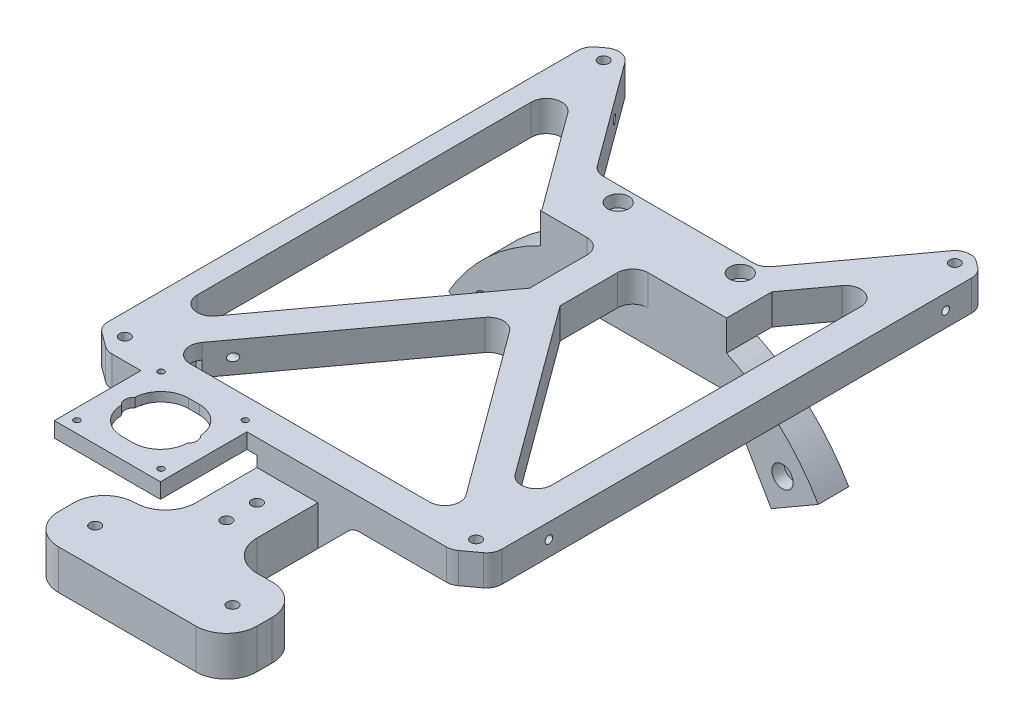
from build123d import *

# Parameters (mm, degrees)
BOSS_EXTRU_1_DEPTH       = 10
ESQUISSE2_W              = 61.02458521
ESQUISSE2_H              = 20
BOSS_EXTRU_2_DEPTH       = 10
ENL_V_MAT_EXTRU_3_REACH  = 98.935
ESQUISSE5_R              = 1.75
ENL_V_MAT_EXTRU_1_REACH  = 79.187
ESQUISSE3_R              = 1.75
ESQUISSE4_R              = 3.5
ENL_V_MAT_EXTRU_2_DEPTH  = 4
ESQUISSE6_R              = 3.5
ENL_V_MAT_EXTRU_4_DEPTH  = 4
ESQUISSE7_R              = 1.75
BOSS_EXTRU_3_DEPTH       = 10
BOSS_EXTRU_4_DEPTH       = 10
ESQUISSE9_R              = 3.5
ENL_V_MAT_EXTRU_5_DEPTH  = 3
BOSS_EXTRU_5_DEPTH       = 13
ENL_V_MAT_EXTRU_6_REACH  = 192.901
ESQUISSE11_R             = 1.75
ENL_V_MAT_EXTRU_9_REACH  = 192.901
ESQUISSE14_R             = 1.75
CONG_2_R                 = 5
CONG_1_R                 = 10
ESQUISSE12_R             = 3.5
ENL_V_MAT_EXTRU_7_DEPTH  = 4.75
ESQUISSE15_R             = 3.5
ENL_V_MAT_EXTRU_10_DEPTH = 7
ENL_V_MAT_EXTRU_11_DEPTH = 5
BOSS_EXTRU_6_DEPTH       = 5
ENL_V_MAT_EXTRU_14_REACH = 195.78
ESQUISSE17_R             = 1
ENL_V_MAT_EXTRU_15_DEPTH = 2
ESQUISSE20_R             = 1.25
ENL_V_MAT_EXTRU_16_DEPTH = 231.047492928
CHANFREIN1_SIZE          = 11.5
CONG_3_R                 = 5
CONG_4_R                 = 9


# Some blends are built 0.0001 mm under size
with BuildPart() as part:
    # Esquisse1 → Boss.-Extru.1 (new body)
    with BuildSketch(Plane.XY):
        with BuildLine():
            Line((-30.13, 52.18), (30.13, 52.18))
            Line((30.13, 52.18), (45.13, 26.199237886))
            Line((45.13, 26.199237886), (60.55958005, 35.107510082))
            ThreePointArc((60.55958005, 35.107510082), (47.623725659, 51.302833784), (30.512292605, 63))
            Line((30.512292605, 63), (-30.512292605, 63))
            ThreePointArc((-30.512292605, 63), (-47.623725659, 51.302833784), (-60.55958005, 35.107510082))
            Line((-60.55958005, 35.107510082), (-45.13, 26.199237886))
            Line((-45.13, 26.199237886), (-30.13, 52.18))
        make_face()
    extrude(amount=BOSS_EXTRU_1_DEPTH)

    # Esquisse2 → Boss.-Extru.2 (add)
    with BuildSketch(Plane(origin=(0, 63, 0), x_dir=(1, 0, 0), z_dir=(0, 1, 0))):
        Rectangle(ESQUISSE2_W, ESQUISSE2_H)
    extrude(amount=BOSS_EXTRU_2_DEPTH)

    # Esquisse5 → Enlèv. mat.-Extru.3 (cut, up to next)
    with BuildSketch(Plane.XY.offset(10), mode=Mode.PRIVATE) as enl_v_mat_extru_3_sk1:
        with Locations((-48.825935482, 37.18)):
            Circle(ESQUISSE5_R)
    enl_v_mat_extru_3_tool1 = extrude(enl_v_mat_extru_3_sk1.sketch, amount=-ENL_V_MAT_EXTRU_3_REACH, mode=Mode.PRIVATE) & part.part
    # Esquisse5 → Enlèv. mat.-Extru.3 (cut, up to next)
    with BuildSketch(Plane.XY.offset(10), mode=Mode.PRIVATE) as enl_v_mat_extru_3_sk2:
        with Locations((48.825935482, 37.18)):
            Circle(ESQUISSE5_R)
    enl_v_mat_extru_3_tool2 = extrude(enl_v_mat_extru_3_sk2.sketch, amount=-ENL_V_MAT_EXTRU_3_REACH, mode=Mode.PRIVATE) & part.part
    add(enl_v_mat_extru_3_tool1.solids().sort_by_distance((-48.825935, 37.18, 10))[0], mode=Mode.SUBTRACT)
    add(enl_v_mat_extru_3_tool2.solids().sort_by_distance((48.825935, 37.18, 10))[0], mode=Mode.SUBTRACT)

    # Esquisse3 → Enlèv. mat.-Extru.1 (cut, up to next)
    with BuildSketch(Plane(origin=(0, 73, 0), x_dir=(1, 0, 0), z_dir=(0, 1, 0)), mode=Mode.PRIVATE) as enl_v_mat_extru_1_sk1:
        with Locations(Location((20, 5, 0), (0, 0, 270))):
            Circle(ESQUISSE3_R)
    enl_v_mat_extru_1_tool1 = extrude(enl_v_mat_extru_1_sk1.sketch, amount=-ENL_V_MAT_EXTRU_1_REACH, mode=Mode.PRIVATE) & part.part
    # Esquisse3 → Enlèv. mat.-Extru.1 (cut, up to next)
    with BuildSketch(Plane(origin=(0, 73, 0), x_dir=(1, 0, 0), z_dir=(0, 1, 0)), mode=Mode.PRIVATE) as enl_v_mat_extru_1_sk2:
        with Locations(Location((-20, 5, 0), (0, 0, 270))):
            Circle(ESQUISSE3_R)
    enl_v_mat_extru_1_tool2 = extrude(enl_v_mat_extru_1_sk2.sketch, amount=-ENL_V_MAT_EXTRU_1_REACH, mode=Mode.PRIVATE) & part.part
    add(enl_v_mat_extru_1_tool1.solids().sort_by_distance((20, 73, -5))[0], mode=Mode.SUBTRACT)
    add(enl_v_mat_extru_1_tool2.solids().sort_by_distance((-20, 73, -5))[0], mode=Mode.SUBTRACT)

    # Esquisse4 → Enlèv. mat.-Extru.2 (cut)
    with BuildSketch(Plane(origin=(0, 73, 0), x_dir=(1, 0, 0), z_dir=(0, 1, 0))):
        with Locations(Location((20, 5, 0), (0, 0, 270))):
            Circle(ESQUISSE4_R)
        with Locations(Location((-20, 5, 0), (0, 0, 270))):
            Circle(ESQUISSE4_R)
    extrude(amount=-ENL_V_MAT_EXTRU_2_DEPTH, mode=Mode.SUBTRACT)

    # Esquisse6 → Enlèv. mat.-Extru.4 (cut)
    with BuildSketch(Plane.XY.offset(10)):
        with Locations((-48.825935482, 37.18)):
            Circle(ESQUISSE6_R)
        with Locations((48.825935482, 37.18)):
            Circle(ESQUISSE6_R)
    extrude(amount=-ENL_V_MAT_EXTRU_4_DEPTH, mode=Mode.SUBTRACT)

    # Esquisse7 → Boss.-Extru.3 (add)
    with BuildSketch(Plane(origin=(0, 73, 0), x_dir=(1, 0, 0), z_dir=(0, 1, 0))):
        Polygon((-10.23, -10), (-10.23, -33.81291819), (-62.77, -105.445921319), (-62.77, 34.545921319), (-30.512292605, -9.434216762), (-30.512292605, 10), (-32.36505816, 10), (-61.695372628, 49.988932394), (-69.758932394, 44.074627372), (-69.758932394, -114.974627372), (-61.695372628, -120.888932394), (-5.23, -43.904078681), (51.235372628, -120.888932394), (59.298932394, -114.974627372), (59.298932394, 44.074627372), (51.235372628, 49.988932394), (21.90505816, 10), (30.512292605, 10), (30.512292605, 4.826940694), (49.298932394, 30.440633629), (49.298932394, -101.340633629), (-0.23, -33.81291819), (-0.23, -10), align=None)
        with Locations(Location((52.31, -113.9, 0), (0, 0, 270))):
            Circle(ESQUISSE7_R, mode=Mode.SUBTRACT)
        with Locations(Location((-62.77, -113.9, 0), (0, 0, 270))):
            Circle(ESQUISSE7_R, mode=Mode.SUBTRACT)
        with Locations(Location((-62.77, 43, 0), (0, 0, 270))):
            Circle(ESQUISSE7_R, mode=Mode.SUBTRACT)
        with Locations(Location((52.31, 43, 0), (0, 0, 270))):
            Circle(ESQUISSE7_R, mode=Mode.SUBTRACT)
    extrude(amount=-BOSS_EXTRU_3_DEPTH)

    # Esquisse8 → Boss.-Extru.4 (add)
    with BuildSketch(Plane(origin=(0, 73, 0), x_dir=(1, 0, 0), z_dir=(0, 1, 0))):
        Polygon((51.235372628, -120.888932394), (43.900764597, -110.888932394), (-54.360764597, -110.888932394), (-61.695372628, -120.888932394), align=None)
    extrude(amount=-BOSS_EXTRU_4_DEPTH)

    # Esquisse9 → Enlèv. mat.-Extru.5 (cut)
    with BuildSketch(Plane(origin=(0, 63, 0), x_dir=(-1, 0, 0), z_dir=(0, -1, 0))):
        with Locations(Location((-52.31, -113.9, 0), (0, 0, 90))):
            Circle(ESQUISSE9_R)
        with Locations(Location((62.77, -113.9, 0), (0, 0, 90))):
            Circle(ESQUISSE9_R)
        with Locations(Location((62.77, 43, 0), (0, 0, 90))):
            Circle(ESQUISSE9_R)
        with Locations(Location((-52.31, 43, 0), (0, 0, 90))):
            Circle(ESQUISSE9_R)
    extrude(amount=-ENL_V_MAT_EXTRU_5_DEPTH, mode=Mode.SUBTRACT)

    # Esquisse10 → Boss.-Extru.5 (add)
    with BuildSketch(Plane(origin=(0, 64.5, 0), x_dir=(-1, 0, 0), z_dir=(0, -1, 0))):
        Polygon((32.5, -175.888932394), (-32.5, -175.888932394), (-32.5, -150.888932394), (-7.5, -150.888932394), (-7.5, -110.888932394), (12.5, -110.888932394), (12.5, -150.888932394), (32.5, -150.888932394), align=None)
    extrude(amount=BOSS_EXTRU_5_DEPTH)

    # Esquisse11 → Enlèv. mat.-Extru.6 (cut, up to next)
    with BuildSketch(Plane.XZ.offset(-51.5), mode=Mode.PRIVATE) as enl_v_mat_extru_6_sk1:
        with Locations(Location((-22.5, 163.888932394, 0), (0, 0, 270))):
            Circle(ESQUISSE11_R)
    enl_v_mat_extru_6_tool1 = extrude(enl_v_mat_extru_6_sk1.sketch, amount=-ENL_V_MAT_EXTRU_6_REACH, mode=Mode.PRIVATE) & part.part
    # Esquisse11 → Enlèv. mat.-Extru.6 (cut, up to next)
    with BuildSketch(Plane.XZ.offset(-51.5), mode=Mode.PRIVATE) as enl_v_mat_extru_6_sk2:
        with Locations(Location((22.5, 163.888932394, 0), (0, 0, 270))):
            Circle(ESQUISSE11_R)
    enl_v_mat_extru_6_tool2 = extrude(enl_v_mat_extru_6_sk2.sketch, amount=-ENL_V_MAT_EXTRU_6_REACH, mode=Mode.PRIVATE) & part.part
    add(enl_v_mat_extru_6_tool1.solids().sort_by_distance((-22.5, 51.5, 163.888932))[0], mode=Mode.SUBTRACT)
    add(enl_v_mat_extru_6_tool2.solids().sort_by_distance((22.5, 51.5, 163.888932))[0], mode=Mode.SUBTRACT)

    # Esquisse14 → Enlèv. mat.-Extru.9 (cut, up to next)
    with BuildSketch(Plane.XZ.offset(-51.5), mode=Mode.PRIVATE) as enl_v_mat_extru_9_sk1:
        with Locations(Location((-2.5, 140.888932394, 0), (0, 0, 270))):
            Circle(ESQUISSE14_R)
    enl_v_mat_extru_9_tool1 = extrude(enl_v_mat_extru_9_sk1.sketch, amount=-ENL_V_MAT_EXTRU_9_REACH, mode=Mode.PRIVATE) & part.part
    # Esquisse14 → Enlèv. mat.-Extru.9 (cut, up to next)
    with BuildSketch(Plane.XZ.offset(-51.5), mode=Mode.PRIVATE) as enl_v_mat_extru_9_sk2:
        with Locations(Location((-2.5, 130.888932394, 0), (0, 0, 270))):
            Circle(ESQUISSE14_R)
    enl_v_mat_extru_9_tool2 = extrude(enl_v_mat_extru_9_sk2.sketch, amount=-ENL_V_MAT_EXTRU_9_REACH, mode=Mode.PRIVATE) & part.part
    add(enl_v_mat_extru_9_tool1.solids().sort_by_distance((-2.5, 51.5, 140.888932))[0], mode=Mode.SUBTRACT)
    add(enl_v_mat_extru_9_tool2.solids().sort_by_distance((-2.5, 51.5, 130.888932))[0], mode=Mode.SUBTRACT)

    # Congé2
    cong_2_edges = [part.edges().sort_by_distance(p)[0] for p in [
        (-54.360764597, 68, 110.888932394),
        (43.900764597, 68, 110.888932394),
        (-62.77, 68, 105.445921319),
        (-62.77, 68, -34.545921319),
        (-32.36505816, 68, -10),
        (-61.695372628, 68, -49.988932394),
        (-69.758932394, 68, -44.074627372),
        (-69.758932394, 68, 114.974627372),
        (-61.695372628, 68, 120.888932394),
        (-5.23, 68, 43.904078681),
        (51.235372628, 68, 120.888932394),
        (59.298932394, 68, 114.974627372),
        (59.298932394, 68, -44.074627372),
        (51.235372628, 68, -49.988932394),
        (21.90505816, 68, -10),
        (49.298932394, 68, -30.440633629),
        (49.298932394, 68, 101.340633629),
        (-0.23, 68, 10),
        (-10.23, 68, 10),
    ]]
    fillet(cong_2_edges, radius=CONG_2_R)

    # Congé1
    cong_1_edges = [part.edges().sort_by_distance(p)[0] for p in [
        (-12.5, 58, 150.888932394),
        (-32.5, 58, 175.888932394),
        (-32.5, 58, 150.888932394),
        (7.5, 58, 150.888932394),
        (32.5, 58, 150.888932394),
        (32.5, 58, 175.888932394),
    ]]
    fillet(cong_1_edges, radius=CONG_1_R - 0.0001)  # a hair under: the kernel refuses the full size

    # Esquisse12 → Enlèv. mat.-Extru.7 (cut)
    with BuildSketch(Plane.XZ.offset(-51.5)):
        with Locations(Location((-22.5, 163.888932394, 0), (0, 0, 270))):
            Circle(ESQUISSE12_R)
        with Locations(Location((22.5, 163.888932394, 0), (0, 0, 270))):
            Circle(ESQUISSE12_R)
    extrude(amount=-ENL_V_MAT_EXTRU_7_DEPTH, mode=Mode.SUBTRACT)

    # Esquisse15 → Enlèv. mat.-Extru.10 (cut)
    with BuildSketch(Plane.XZ.offset(-51.5)):
        with Locations(Location((-2.5, 140.888932394, 0), (0, 0, 270))):
            Circle(ESQUISSE15_R)
        with Locations(Location((-2.5, 130.888932394, 0), (0, 0, 270))):
            Circle(ESQUISSE15_R)
    extrude(amount=-ENL_V_MAT_EXTRU_10_DEPTH, mode=Mode.SUBTRACT)

    # Esquisse16 → Enlèv. mat.-Extru.11 (cut)
    with BuildSketch(Plane.XZ.offset(-63)):
        with BuildLine():
            Line((-12.5, 120.888932394), (-50.5, 120.888932394))
            Line((-50.5, 120.888932394), (-50.5, 102.931779883))
            Line((-50.5, 102.931779883), (-48.524505126, 102.931779883))
            ThreePointArc((-48.524505126, 102.931779883), (-48.952868882, 108.148825914), (-44.492725243, 110.888932394))
            Line((-44.492725243, 110.888932394), (-12.5, 110.888932394))
            Line((-12.5, 110.888932394), (-12.5, 120.888932394))
        make_face()
    extrude(amount=-ENL_V_MAT_EXTRU_11_DEPTH, mode=Mode.SUBTRACT)

    # Esquisse19 → Boss.-Extru.6 (add)
    with BuildSketch(Plane.XZ.offset(-68)):
        with BuildLine():
            Line((-50.5, 120.888932394), (-50.5, 149.253932394))
            Line((-50.5, 149.253932394), (-15.77, 149.253932394))
            Line((-15.77, 149.253932394), (-15.77, 120.888932394))
            Line((-15.77, 120.888932394), (-22.34470869, 120.888932394))
            Line((-22.34470869, 120.888932394), (-22.34470869, 129.442864417))
            ThreePointArc((-22.34470869, 129.442864417), (-21.34470869, 131.678932394), (-22.34470869, 133.915000372))
            Line((-22.34470869, 133.915000372), (-22.34470869, 142.679223704))
            Line((-22.34470869, 142.679223704), (-43.92529131, 142.679223704))
            Line((-43.92529131, 142.679223704), (-43.92529131, 133.915000372))
            ThreePointArc((-43.92529131, 133.915000372), (-44.92529131, 131.678932394), (-43.92529131, 129.442864417))
            Line((-43.92529131, 129.442864417), (-43.92529131, 120.888932394))
            Line((-43.92529131, 120.888932394), (-50.5, 120.888932394))
        make_face()
    extrude(amount=-BOSS_EXTRU_6_DEPTH)

    # Esquisse17 → Enlèv. mat.-Extru.14 (cut, up to next)
    with BuildSketch(Plane(origin=(0, 68, 0), x_dir=(-1, 0, 0), z_dir=(0, -1, 0)), mode=Mode.PRIVATE) as enl_v_mat_extru_14_sk1:
        with Locations(Location((46.92529131, -117.888932394, 0), (0, 0, 90))):
            Circle(ESQUISSE17_R)
    enl_v_mat_extru_14_tool1 = extrude(enl_v_mat_extru_14_sk1.sketch, amount=-ENL_V_MAT_EXTRU_14_REACH, mode=Mode.PRIVATE) & part.part
    # Esquisse17 → Enlèv. mat.-Extru.14 (cut, up to next)
    with BuildSketch(Plane(origin=(0, 68, 0), x_dir=(-1, 0, 0), z_dir=(0, -1, 0)), mode=Mode.PRIVATE) as enl_v_mat_extru_14_sk2:
        with Locations(Location((19.34470869, -117.888932394, 0), (0, 0, 90))):
            Circle(ESQUISSE17_R)
    enl_v_mat_extru_14_tool2 = extrude(enl_v_mat_extru_14_sk2.sketch, amount=-ENL_V_MAT_EXTRU_14_REACH, mode=Mode.PRIVATE) & part.part
    # Esquisse17 → Enlèv. mat.-Extru.14 (cut, up to next)
    with BuildSketch(Plane(origin=(0, 68, 0), x_dir=(-1, 0, 0), z_dir=(0, -1, 0)), mode=Mode.PRIVATE) as enl_v_mat_extru_14_sk3:
        with Locations(Location((46.92529131, -145.469515014, 0), (0, 0, 90))):
            Circle(ESQUISSE17_R)
    enl_v_mat_extru_14_tool3 = extrude(enl_v_mat_extru_14_sk3.sketch, amount=-ENL_V_MAT_EXTRU_14_REACH, mode=Mode.PRIVATE) & part.part
    # Esquisse17 → Enlèv. mat.-Extru.14 (cut, up to next)
    with BuildSketch(Plane(origin=(0, 68, 0), x_dir=(-1, 0, 0), z_dir=(0, -1, 0)), mode=Mode.PRIVATE) as enl_v_mat_extru_14_sk4:
        with Locations(Location((19.34470869, -145.469515014, 0), (0, 0, 90))):
            Circle(ESQUISSE17_R)
    enl_v_mat_extru_14_tool4 = extrude(enl_v_mat_extru_14_sk4.sketch, amount=-ENL_V_MAT_EXTRU_14_REACH, mode=Mode.PRIVATE) & part.part
    add(enl_v_mat_extru_14_tool1.solids().sort_by_distance((-46.925291, 68, 117.888932))[0], mode=Mode.SUBTRACT)
    add(enl_v_mat_extru_14_tool2.solids().sort_by_distance((-19.344709, 68, 117.888932))[0], mode=Mode.SUBTRACT)
    add(enl_v_mat_extru_14_tool3.solids().sort_by_distance((-46.925291, 68, 145.469515))[0], mode=Mode.SUBTRACT)
    add(enl_v_mat_extru_14_tool4.solids().sort_by_distance((-19.344709, 68, 145.469515))[0], mode=Mode.SUBTRACT)

    # Esquisse18 → Enlèv. mat.-Extru.15 (cut)
    with BuildSketch(Plane(origin=(0, 68, 0), x_dir=(-1, 0, 0), z_dir=(0, -1, 0))):
        Polygon((43.92529131, -120.888932394), (43.92529131, -115.888932394), (22.34470869, -115.888932394), (22.34470869, -120.888932394), (17.34470869, -120.888932394), (17.34470869, -125.679223704), (22.34470869, -125.679223704), (22.34470869, -147.679223704), (43.92529131, -147.679223704), (43.92529131, -142.679223704), (48.92529131, -142.679223704), (48.92529131, -120.888932394), align=None)
    extrude(amount=-ENL_V_MAT_EXTRU_15_DEPTH, mode=Mode.SUBTRACT)

    # Esquisse20 → Enlèv. mat.-Extru.16 (cut, through all)
    with BuildSketch(Plane(origin=(59.298932394, 0, 0), x_dir=(0, 0, -1), z_dir=(1, 0, 0))):
        with Locations((-97, 68)):
            Circle(ESQUISSE20_R)
        with Locations((33, 68)):
            Circle(ESQUISSE20_R)
    extrude(amount=-ENL_V_MAT_EXTRU_16_DEPTH, mode=Mode.SUBTRACT)

    # Chanfrein1
    chanfrein1_edges = [part.edges().sort_by_distance(p)[0] for p in [
        (7.5, 63, 115.888932394),
    ]]
    chamfer(chanfrein1_edges, length=CHANFREIN1_SIZE - 0.0001)  # a hair under: the kernel refuses the full size

    # Congé3
    cong_3_edges = [part.edges().sort_by_distance(p)[0] for p in [
        (18.9999, 63, 115.888932394),
    ]]
    fillet(cong_3_edges, radius=CONG_3_R)

    # Congé4
    # the kernel refuses this fillet: 9 mm, written as the material it adds along each edge
    with BuildSketch(Plane(origin=(-43.92529131, 70, 142.679223704), x_dir=(0, 0, -1), z_dir=(0, 1, 0))) as cong_4_piece_1:
        with BuildLine():
            CenterArc((9, -8.996911101), CONG_4_R, 91.501172628, 88.498827372)
            Line((0, -8.996911101), (-0.18, -8.996911101))
            Line((-0.18, -8.996911101), (-0.18, 0))
            Line((-0.18, 0), (0, 0.18))
            ThreePointArc((0, 0.18), (4.382111666, 0.18), (8.759507799, 0.179938222))
            Line((8.759507799, 0.179938222), (8.764223333, 0))
        make_face()
    extrude(amount=3)
    with BuildSketch(Plane(origin=(-43.92529131, 70, 120.888932394), x_dir=(1, 0, 0), z_dir=(0, 1, 0))) as cong_4_piece_2:
        with BuildLine():
            CenterArc((8.988938945, -9), CONG_4_R, 90, 87.159079125)
            Line((0, -8.553932023), (-0.179778779, -8.545010663))
            ThreePointArc((-0.179778779, -8.545010663), (-0.18, -4.276966011), (-0.18, 0))
            Line((-0.18, 0), (0, 0.18))
            Line((0, 0.18), (8.988938945, 0.18))
            Line((8.988938945, 0.18), (8.988938945, 0))
        make_face()
    extrude(amount=3)
    with BuildSketch(Plane(origin=(-22.34470869, 47.527652637, 120.888932394), x_dir=(-1, 0, 0), z_dir=(0, 1, 0))) as cong_4_piece_3_section:
        with BuildLine():
            CenterArc((8.988938945, 9), CONG_4_R, 182.840920875, 87.159079125)
            Line((0, 8.553932023), (-0.179778779, 8.545010663))
            ThreePointArc((-0.179778779, 8.545010663), (-0.18, 4.276966011), (-0.18, 0))
            Line((-0.18, 0), (0, -0.18))
            Line((0, -0.18), (8.988938945, -0.18))
            Line((8.988938945, -0.18), (8.988938945, 0))
        make_face()
    cong_4_piece_3 = extrude(amount=25.472347363, mode=Mode.PRIVATE)
    cong_4_piece_3 = split(cong_4_piece_3, bisect_by=Plane(origin=(-22.522742676, 68, 126.974848548), z_dir=(0, 1, 0)), keep=Keep.TOP, mode=Mode.PRIVATE)
    cong_4_piece_3 = split(cong_4_piece_3, bisect_by=Plane(origin=(-22.522742676, 70, 126.974848548), z_dir=(0, -1, 0)), keep=Keep.TOP, mode=Mode.PRIVATE)
    cong_4_piece_3 = split(cong_4_piece_3, bisect_by=Plane(origin=(-22.522742676, 69, 125.679223704), z_dir=(0, 0, 1)), keep=Keep.TOP, mode=Mode.PRIVATE)
    add(cong_4_piece_3)
    with BuildSketch(Plane(origin=(-22.34470869, 70, 120.888932394), x_dir=(-1, 0, 0), z_dir=(0, 1, 0))) as cong_4_piece_4_section:
        with BuildLine():
            CenterArc((8.988938945, 9), CONG_4_R, 182.840920875, 87.159079125)
            Line((0, 8.553932023), (-0.179778779, 8.545010663))
            ThreePointArc((-0.179778779, 8.545010663), (-0.18, 4.276966011), (-0.18, 0))
            Line((-0.18, 0), (0, -0.18))
            Line((0, -0.18), (8.988938945, -0.18))
            Line((8.988938945, -0.18), (8.988938945, 0))
        make_face()
    cong_4_piece_4 = extrude(amount=3, mode=Mode.PRIVATE)
    cong_4_piece_4 = split(cong_4_piece_4, bisect_by=Plane(origin=(-24.601694506, 71.5, 125.679223704), z_dir=(0, 0, -1)), keep=Keep.TOP, mode=Mode.PRIVATE)
    add(cong_4_piece_4)
    with BuildSketch(Plane(origin=(-22.34470869, 70, 120.888932394), x_dir=(-1, 0, 0), z_dir=(0, 1, 0))) as cong_4_piece_5_section:
        with BuildLine():
            CenterArc((8.988938945, 9), CONG_4_R, 182.840920875, 87.159079125)
            Line((0, 8.553932023), (-0.179778779, 8.545010663))
            ThreePointArc((-0.179778779, 8.545010663), (-0.18, 4.276966011), (-0.18, 0))
            Line((-0.18, 0), (0, -0.18))
            Line((0, -0.18), (8.988938945, -0.18))
            Line((8.988938945, -0.18), (8.988938945, 0))
        make_face()
    cong_4_piece_5 = extrude(amount=3, mode=Mode.PRIVATE)
    cong_4_piece_5 = split(cong_4_piece_5, bisect_by=Plane(origin=(-22.522742676, 71.5, 125.679223704), z_dir=(0, 0, 1)), keep=Keep.TOP, mode=Mode.PRIVATE)
    add(cong_4_piece_5)
    with BuildSketch(Plane(origin=(-22.34470869, 70, 142.679223704), x_dir=(0, 0, -1), z_dir=(0, 1, 0))) as cong_4_piece_6:
        with BuildLine():
            CenterArc((9, 8.996911101), CONG_4_R, 180, 88.498827372)
            Line((0, 8.996911101), (-0.18, 8.996911101))
            Line((-0.18, 8.996911101), (-0.18, 0))
            Line((-0.18, 0), (0, -0.18))
            ThreePointArc((0, -0.18), (4.382111666, -0.18), (8.759507799, -0.179938222))
            Line((8.759507799, -0.179938222), (8.764223333, 0))
        make_face()
    extrude(amount=3)


solid = part.part
